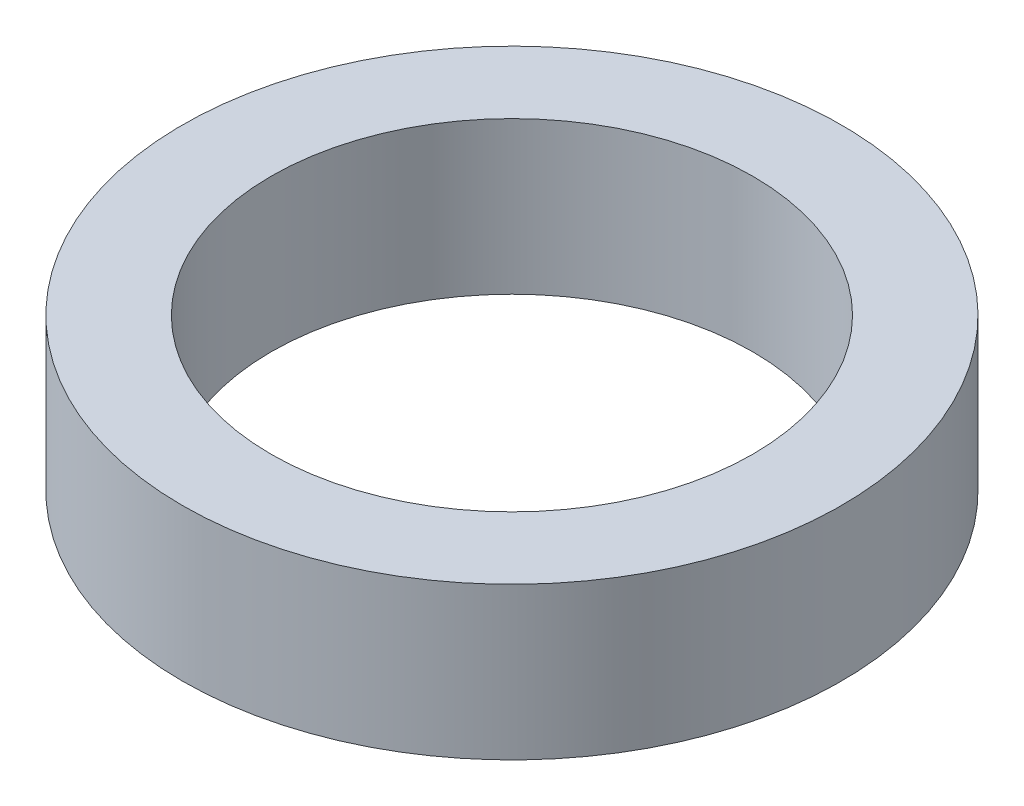
from build123d import *

# Parameters (mm, degrees)
SKETCH1_R           = 65
BOSS_EXTRUDE1_DEPTH = 30
SKETCH2_R           = 47.5
CUT_EXTRUDE1_DEPTH  = 97.695398029


with BuildPart() as part:
    # Sketch1 → Boss-Extrude1 (new body)
    with BuildSketch(Plane(origin=(0, 0, 0), x_dir=(1, 0, 0), z_dir=(0, 1, 0))):
        Circle(SKETCH1_R)
    extrude(amount=BOSS_EXTRUDE1_DEPTH)

    # Sketch2 → Cut-Extrude1 (cut, through all)
    with BuildSketch(Plane(origin=(0, 0, 0), x_dir=(1, 0, 0), z_dir=(0, 1, 0))):
        Circle(SKETCH2_R)
    extrude(amount=CUT_EXTRUDE1_DEPTH, mode=Mode.SUBTRACT)


solid = part.part
